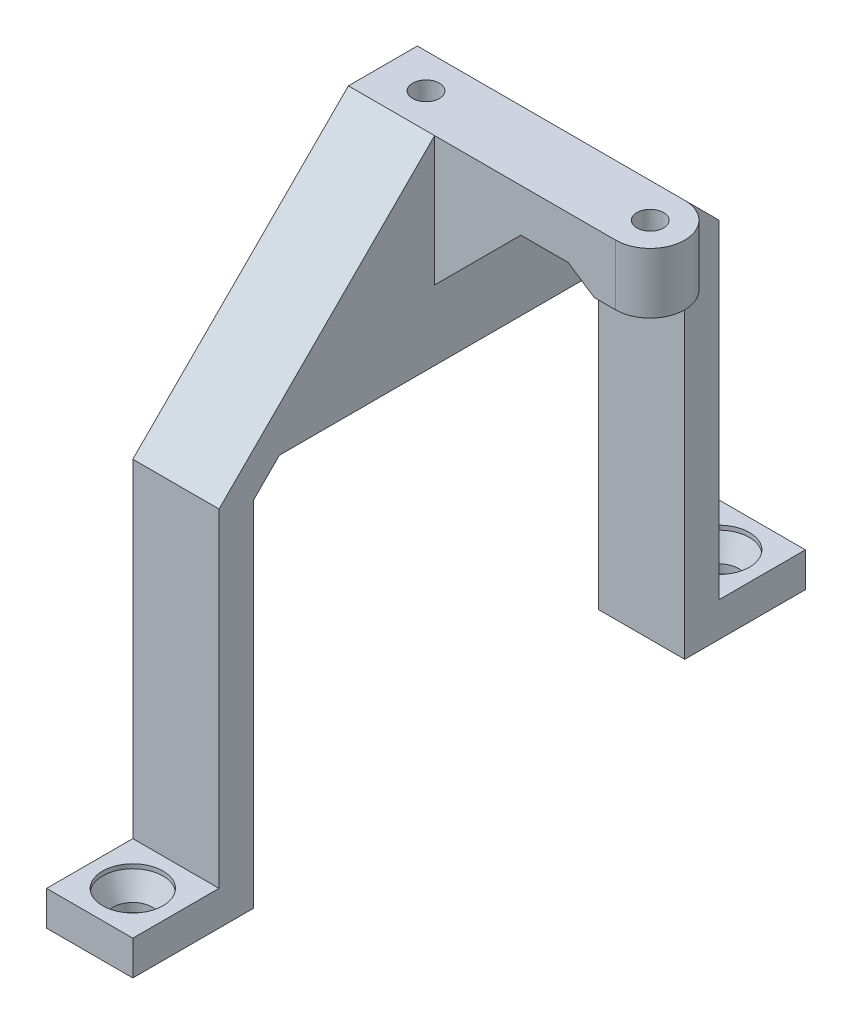
from build123d import *
from build123d.topology import SkipClean

# Parameters (mm, degrees)
SKETCH1_R                 = 1.55
BOSS_EXTRUDE1_DEPTH       = 5
BOSS_EXTRUDE2_START       = 2
SKETCH2_R                 = 1.55
BOSS_EXTRUDE2_DEPTH       = 2
CHAMFER1_SIZE2            = 2
CHAMFER1_SIZE             = 3
BOSS_EXTRUDE3_START       = 18.1
SKETCH3_W                 = 10
SKETCH3_H                 = 8
SKETCH3_R                 = 1.55
BOSS_EXTRUDE3_DEPTH       = 18.1
BOSS_EXTRUDE4_DEPTH       = 10
CHAMFER2_SIZE             = 10
SKETCH6_R                 = 2.25
CUT_EXTRUDE2_DEPTH        = 81.396579529
SKETCH7_R                 = 3.5
CUT_EXTRUDE3_DEPTH        = 3
CHAMFER3_SIZE2            = 1.25
CHAMFER3_SIZE             = 2.5
CHAMFER3_OF_MIRROR2_SIZE2 = 1.25
CHAMFER3_OF_MIRROR2_SIZE  = 2.5


with BuildPart() as part:
    # Sketch1 → Boss-Extrude1 (new body)
    with BuildSketch(Plane(origin=(0, 0, 0), x_dir=(1, 0, 0), z_dir=(0, 1, 0))):
        with BuildLine():
            Line((0, 4), (-31, 4))
            Line((-31, 4), (-31, -4))
            Line((-31, -4), (0, -4))
            ThreePointArc((0, -4), (4, 0), (0, 4))
        make_face()
        with Locations(Location((0, 0, 0), (0, 0, 270))):
            Circle(SKETCH1_R, mode=Mode.SUBTRACT)
        with Locations(Location((-26, 0, 0), (0, 0, 270))):
            Circle(SKETCH1_R, mode=Mode.SUBTRACT)
    extrude(amount=BOSS_EXTRUDE1_DEPTH)

    # Sketch2 → Boss-Extrude2 (add)
    with SkipClean():  # the faces are left unmerged after this step: merging them gives an invalid solid
        with BuildSketch(Plane.XZ.offset(BOSS_EXTRUDE2_START)):
            with BuildLine():
                Line((0, 4), (-2.5, 4))
                Line((-2.5, 4), (-2.5, -4))
                Line((-2.5, -4), (0, -4))
                ThreePointArc((0, -4), (4, 0), (0, 4))
            make_face()
            with Locations(Location((0, 0, 0), (0, 0, 270))):
                Circle(SKETCH2_R, mode=Mode.SUBTRACT)
        extrude(amount=-BOSS_EXTRUDE2_DEPTH)

    # Chamfer1
    chamfer1_edges = [part.edges().sort_by_distance(p)[0] for p in [
        (-2.5, 0, 0),
    ]]
    chamfer1_side = [part.faces().sort_by_distance(p)[0] for p in [
        (-2.54, 0, 0),
    ]]
    chamfer(chamfer1_edges, length=CHAMFER1_SIZE - 0.0001, length2=CHAMFER1_SIZE2 - 0.0001, reference=chamfer1_side[0])  # a hair under: the kernel refuses the full size

    # Sketch3 → Boss-Extrude3 (add)
    with BuildSketch(Plane.XZ.offset(BOSS_EXTRUDE3_START)):
        with Locations((-26, 0)):
            Rectangle(SKETCH3_W, SKETCH3_H)
        with Locations(Location((-26, 0, 0), (0, 0, 270))):
            Circle(SKETCH3_R, mode=Mode.SUBTRACT)
    extrude(amount=-BOSS_EXTRUDE3_DEPTH)

    # Sketch4 → Boss-Extrude4 (add)
    with BuildSketch(Plane.ZY.offset(31)):
        Polygon((-4, -18.1), (-22, -18.1), (-25, -21.1), (-25, -62.1), (-39, -62.1), (-39, -58.1), (-29, -58.1), (-29, -20), (-4, 5), align=None)
    boss_extrude4 = extrude(amount=-BOSS_EXTRUDE4_DEPTH)

    # Mirror1: Boss-Extrude4 across plane
    add(boss_extrude4.mirror(Plane.XY))

    # Chamfer2
    chamfer2_edges = [part.edges().sort_by_distance(p)[0] for p in [
        (-21, 0, 0),
    ]]
    chamfer(chamfer2_edges, length=CHAMFER2_SIZE)

    # Sketch6 → Cut-Extrude2 (cut, through all)
    with BuildSketch(Plane(origin=(0, -58.1, 0), x_dir=(1, 0, 0), z_dir=(0, 1, 0))):
        with Locations(Location((-26, -34, 0), (0, 0, 270))):
            Circle(SKETCH6_R)
    cut_extrude2 = extrude(amount=-CUT_EXTRUDE2_DEPTH, mode=Mode.SUBTRACT)

    # Sketch7 → Cut-Extrude3 (cut)
    with BuildSketch(Plane(origin=(0, -58.1, 0), x_dir=(1, 0, 0), z_dir=(0, 1, 0))):
        with Locations(Location((-26, -34, 0), (0, 0, 270))):
            Circle(SKETCH7_R)
    cut_extrude3 = extrude(amount=-CUT_EXTRUDE3_DEPTH, mode=Mode.SUBTRACT)

    # Chamfer3
    chamfer3_edges = [part.edges().sort_by_distance(p)[0] for p in [
        (-26, -61.1, 30.5),
    ]]
    chamfer3_side = [part.faces().sort_by_distance(p)[0] for p in [
        (-26, -61.075, 30.5),
    ]]
    chamfer(chamfer3_edges, length=CHAMFER3_SIZE - 0.0001, length2=CHAMFER3_SIZE2 - 0.0001, reference=chamfer3_side[0])  # a hair under: the kernel refuses the full size

    # Mirror2: Cut-Extrude2, Cut-Extrude3 across plane
    add(cut_extrude2.mirror(Plane.XY), mode=Mode.SUBTRACT)
    add(cut_extrude3.mirror(Plane.XY), mode=Mode.SUBTRACT)

    # Chamfer3 of Mirror2
    chamfer3_of_mirror2_edges = [part.edges().sort_by_distance(p)[0] for p in [
        (-26, -61.1, -30.5),
    ]]
    chamfer3_of_mirror2_side = [part.faces().sort_by_distance(p)[0] for p in [
        (-26, -61.075, -30.5),
    ]]
    chamfer(chamfer3_of_mirror2_edges, length=CHAMFER3_OF_MIRROR2_SIZE - 0.0001, length2=CHAMFER3_OF_MIRROR2_SIZE2 - 0.0001, reference=chamfer3_of_mirror2_side[0])  # a hair under: the kernel refuses the full size


solid = part.part
